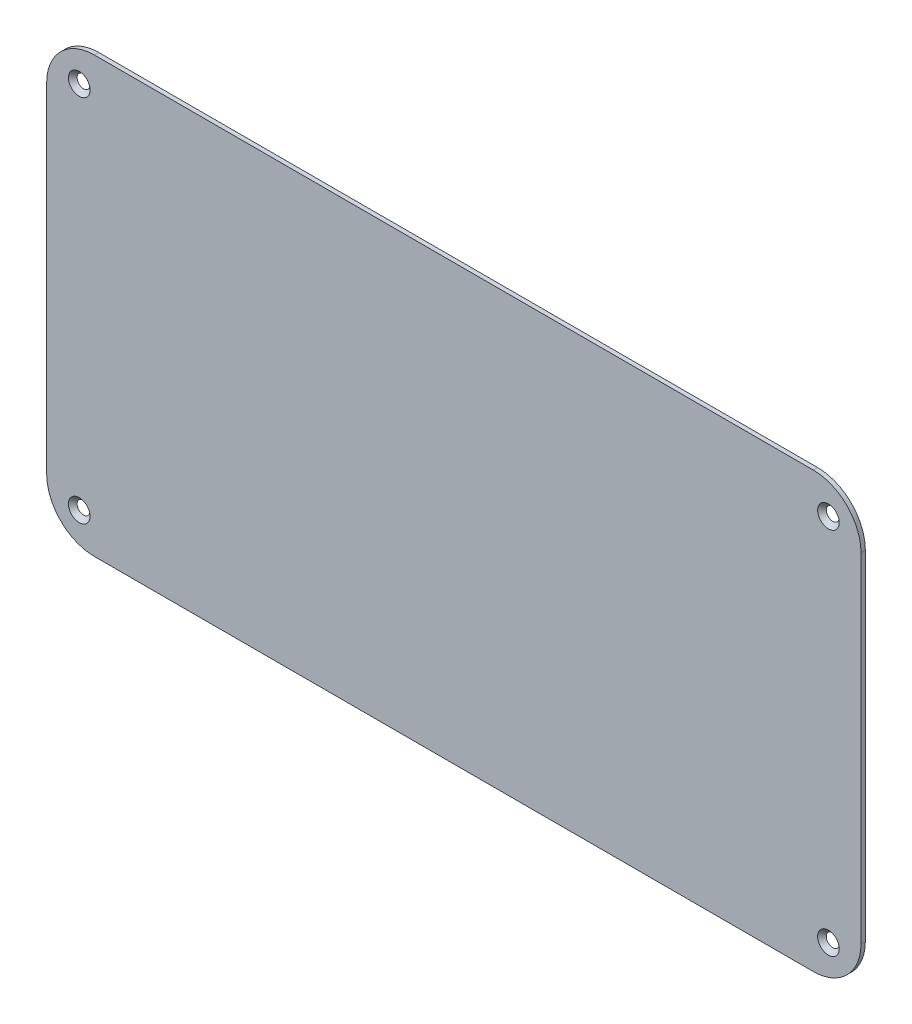
from build123d import *

# Parameters (mm, degrees)
BASE_FLANGE1_DEPTH                           = 2
ESBO_O7_R                                    = 1.5
CORTE_EXTRUS_O1_DEPTH                        = 213.509411556
ESCAREADO_PARA_PARAFUSO_ALLEN_SEXTAV_2_COUNT = 2
ESCAREADO_PARA_PARAFUSO_ALLEN_SEXTAV_2_PITCH = 170
ESCAREADO_PARA_PARAFUSO_ALLEN_SEXTAV_3_COUNT = 2
ESCAREADO_PARA_PARAFUSO_ALLEN_SEXTAV_3_PITCH = 345
ESCAREADO_PARA_PARAFUSO_ALLEN_SEXTAV_4_COUNT = 2
ESCAREADO_PARA_PARAFUSO_ALLEN_SEXTAV_4_PITCH = 384.610192273


# Sheet-metal steps are written as plain solids
with BuildPart() as part:
    # Sketch1 → Base-Flange1 (new body)
    with BuildSketch(Plane.XY):
        with BuildLine():
            Line((-165.5, 100), (165.5, 100))
            ThreePointArc((165.5, 100), (181.056349186, 93.556349186), (187.5, 78))
            Line((187.5, 78), (187.5, -78))
            ThreePointArc((187.5, -78), (181.056349186, -93.556349186), (165.5, -100))
            Line((165.5, -100), (-165.5, -100))
            ThreePointArc((-165.5, -100), (-181.056349186, -93.556349186), (-187.5, -78))
            Line((-187.5, -78), (-187.5, 78))
            ThreePointArc((-187.5, 78), (-181.056349186, 93.556349186), (-165.5, 100))
        make_face()
    extrude(amount=BASE_FLANGE1_DEPTH)

    # Esboço7 → Corte-extrusão1 (cut, through all)
    with BuildSketch(Plane(origin=(0, 0, 0), x_dir=(-1, 0, 0), z_dir=(0, 0, -1))):
        with Locations((-172.5, 85)):
            Circle(ESBO_O7_R)
        with Locations((172.5, 85)):
            Circle(ESBO_O7_R)
        with Locations((-172.5, -85)):
            Circle(ESBO_O7_R)
        with Locations((172.5, -85)):
            Circle(ESBO_O7_R)
    extrude(amount=-CORTE_EXTRUS_O1_DEPTH, mode=Mode.SUBTRACT)

    # Esboço9 → Escareado para parafuso Allen sextavado escareado de M41 (revolve, cut)
    with BuildSketch(Plane(origin=(-172.5, 85, 2), x_dir=(0, -1, 0), z_dir=(1, 0, 0))):
        Polygon((0, 0), (0, 2), (2.15, 2), (2.15, 2.83), (4.98, 0), align=None)
    escareado_para_parafuso_allen_sextavado = revolve(axis=Axis((-172.5, 85, 8.35), (0, 0, -1)), mode=Mode.SUBTRACT)

    # Escareado para parafuso Allen sextav 2: Escareado para parafuso Allen sextavado escareado de M41 ×2
    with Locations(*[(0, -i * ESCAREADO_PARA_PARAFUSO_ALLEN_SEXTAV_2_PITCH, 0) for i in range(1, ESCAREADO_PARA_PARAFUSO_ALLEN_SEXTAV_2_COUNT)]):
        add(escareado_para_parafuso_allen_sextavado, mode=Mode.SUBTRACT)

    # Escareado para parafuso Allen sextav 3: Escareado para parafuso Allen sextavado escareado de M41 ×2
    with Locations(*[(i * ESCAREADO_PARA_PARAFUSO_ALLEN_SEXTAV_3_PITCH, 0, 0) for i in range(1, ESCAREADO_PARA_PARAFUSO_ALLEN_SEXTAV_3_COUNT)]):
        add(escareado_para_parafuso_allen_sextavado, mode=Mode.SUBTRACT)

    # Escareado para parafuso Allen sextav 4: Escareado para parafuso Allen sextavado escareado de M41 ×2
    with Locations(*[Vector(0.8970121097452229, -0.44200596712083445, 0) * (i * ESCAREADO_PARA_PARAFUSO_ALLEN_SEXTAV_4_PITCH) for i in range(1, ESCAREADO_PARA_PARAFUSO_ALLEN_SEXTAV_4_COUNT)]):
        add(escareado_para_parafuso_allen_sextavado, mode=Mode.SUBTRACT)


solid = part.part
